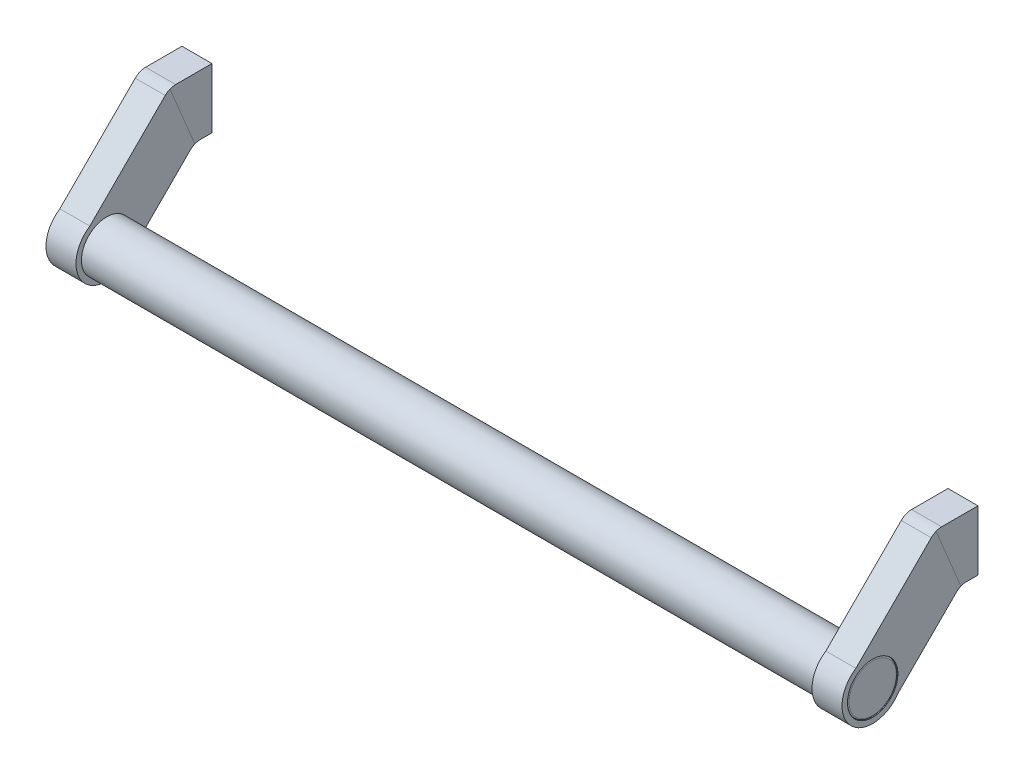
from build123d import *

# Parameters (mm, degrees)
SKETCH3_W                    = 11.938
SKETCH3_H                    = 23.876
HANDLE_START                 = -146.431
SKETCH5_R                    = 12.192
HANDLE_ARM_EXTRUDE_1_DEPTH   = 11.938
SKETCH6_R                    = 12.192
HANDLE_ARM_EXTRUDE_2_DEPTH   = 11.938
HANDLE_CUT_DEPTH             = 173.584963021
HANDLE_CUT_DEPTH_BACK        = 173.584963021
SKETCH7_R                    = 10.033
HANDLE_EXTRUDE_DEPTH         = 158.369
HANDLE_EXTRUDE_DEPTH_BACK    = 158.369
SKETCH8_R                    = 10.033
HANDLE_FILLET_R              = 0.635
HANDLE_ARM_FILLET_R          = 5.842
SKETCH9_R                    = 3.175
HANDLE_THREAD_HOLE_CUT_DEPTH = 12.7
CHAMFER1_SIZE                = 0.635
CUT_SWEEP1_PITCH             = 1.27
LPATTERN1_COUNT              = 2
LPATTERN1_PITCH              = 304.8


with BuildPart() as part:
    # Handle Arm Sweep: sweep along a path in Sketch4
    with BuildLine(Plane(origin=(0, 0, 0), x_dir=(0, 0, -1), z_dir=(1, 0, 0))) as handle_arm_sweep_path:
        Line((0, 0), (-11.938, 0))
        Line((-11.938, 0), (-41.91, -29.972))
    # Sketch3 → Handle Arm Sweep (sweep)
    with BuildSketch(Plane.XY):
        with Locations((152.4, 0)):
            Rectangle(SKETCH3_W, SKETCH3_H)
        with Locations((-152.4, 0)):
            Rectangle(SKETCH3_W, SKETCH3_H)
    sweep(path=handle_arm_sweep_path.line, transition=Transition.RIGHT)

    # Sketch5 → Handle Arm Extrude 1 (add)
    with BuildSketch(Plane(origin=(0, 0, 0), x_dir=(0, 0, -1), z_dir=(1, 0, 0)).offset(HANDLE_START)):
        with Locations((-41.91, -29.972)):
            Circle(SKETCH5_R)
    extrude(amount=-HANDLE_ARM_EXTRUDE_1_DEPTH)

    # Sketch6 → Handle Arm Extrude 2 (add)
    with BuildSketch(Plane(origin=(158.369, 0, 0), x_dir=(0, 0, -1), z_dir=(1, 0, 0))):
        with Locations((-41.91, -29.972)):
            Circle(SKETCH6_R)
    extrude(amount=-HANDLE_ARM_EXTRUDE_2_DEPTH)

    # Sketch7 → Handle Cut (cut, two sides: drawn at the far end of the back side and taken through both)
    with BuildSketch(Plane(origin=(0, 0, 0), x_dir=(0, 0, -1), z_dir=(1, 0, 0)).offset(-HANDLE_CUT_DEPTH_BACK)):
        with Locations((-41.91, -29.972)):
            Circle(SKETCH7_R)
    extrude(amount=HANDLE_CUT_DEPTH + HANDLE_CUT_DEPTH_BACK, mode=Mode.SUBTRACT)


with BuildPart() as body_2:
    # Sketch8 → Handle Extrude (new, two sides: drawn at the far end of the back side and taken through both)
    with BuildSketch(Plane(origin=(0, 0, 0), x_dir=(0, 0, -1), z_dir=(1, 0, 0)).offset(-HANDLE_EXTRUDE_DEPTH_BACK)):
        with Locations(Location((-41.91, -29.972, 0), (0, 0, 180))):
            Circle(SKETCH8_R)
    extrude(amount=HANDLE_EXTRUDE_DEPTH + HANDLE_EXTRUDE_DEPTH_BACK)

    # Handle Fillet
    handle_fillet_edges = [body_2.edges().sort_by_distance(p)[0] for p in [
        (-158.369, -29.972, 31.877),
        (158.369, -29.972, 31.877),
    ]]
    fillet(handle_fillet_edges, radius=HANDLE_FILLET_R)


with BuildPart() as part_1:
    add(part.part)

    # Handle Combine: union body 2
    add(body_2.part)

    # Handle Arm Fillet
    handle_arm_fillet_edges = [part_1.edges().sort_by_distance(p)[0] for p in [
        (-152.4, 11.938, 16.882881508),
        (-152.4, -11.938, 6.993118492),
        (152.4, 11.938, 16.882881508),
        (152.4, -11.938, 6.993118492),
    ]]
    fillet(handle_arm_fillet_edges, radius=HANDLE_ARM_FILLET_R)

    # Sketch9 → Handle Thread Hole Cut (cut)
    with BuildSketch(Plane(origin=(0, 0, 0), x_dir=(-1, 0, 0), z_dir=(0, 0, -1))):
        with Locations((152.4, 0)):
            Circle(SKETCH9_R)
        with Locations((-152.4, 0)):
            Circle(SKETCH9_R)
    extrude(amount=-HANDLE_THREAD_HOLE_CUT_DEPTH, mode=Mode.SUBTRACT)

    # Chamfer1
    chamfer1_edges = [part_1.edges().sort_by_distance(p)[0] for p in [
        (-149.225, 0, 0),
        (155.575, 0, 0),
    ]]
    chamfer(chamfer1_edges, length=CHAMFER1_SIZE)

    # Cut-Sweep1: arcs per turn and ends read off the stored shape
    # Cut-Sweep1: the profile of Sketch11 screwed along a right-hand helix through 11 turns, 8 arcs to a turn; built about Z, then put on its axis
    cut_sweep1_z = Axis((0, 0, 0), (0, 0, 1))
    cut_sweep1_corners = [(3.106259234, 0, 0.0396875), (3.106259234, 0, -1.1509375), (3.999889197, 0, -0.635), (3.999889197, 0, -0.47625)]
    with BuildLine(mode=Mode.PRIVATE) as cut_sweep1_profile:
        Line(cut_sweep1_corners[0], cut_sweep1_corners[1])
        Line(cut_sweep1_corners[1], cut_sweep1_corners[2])
        Line(cut_sweep1_corners[2], cut_sweep1_corners[3])
        Line(cut_sweep1_corners[3], cut_sweep1_corners[0])
    cut_sweep1_cap = Face(cut_sweep1_profile.wire())
    cut_sweep1_turn_angles = [0, 22.5, 45, 67.5, 90, 112.5, 135, 157.5, 180, 202.5, 225, 247.5, 270, 292.5, 315, 337.5, 360]
    cut_sweep1_turn_weights = [1, 0.9238795325112867, 1, 0.9238795325112867, 1, 0.9238795325112867, 1, 0.9238795325112867, 1, 0.9238795325112867, 1, 0.9238795325112867, 1, 0.9238795325112867, 1, 0.9238795325112867, 1]
    cut_sweep1_turn_rails = [Edge.make_bspline([Vector(p[0], p[1], 0).rotate(cut_sweep1_z, cut_sweep1_turn_angles[k]) / cut_sweep1_turn_weights[k] + Vector(0, 0, p[2] + CUT_SWEEP1_PITCH * cut_sweep1_turn_angles[k] / 360) for k in range(17)], [0, 0, 0, 1, 1, 2, 2, 3, 3, 4, 4, 5, 5, 6, 6, 7, 7, 8, 8, 8], 2, cut_sweep1_turn_weights) for p in cut_sweep1_corners]
    cut_sweep1_turn_sides = [Face.make_surface_from_curves(cut_sweep1_turn_rails[p[0]], cut_sweep1_turn_rails[p[1]]) for p in [(0, 1), (1, 2), (2, 3), (3, 0)]]
    cut_sweep1 = Plane(origin=(152.4, 0, 0), x_dir=(1, 0, 0), z_dir=(0, 0, 1)) * Solid(Shell([*[p.moved(Location((0, 0, CUT_SWEEP1_PITCH * i))) for i in range(11) for p in cut_sweep1_turn_sides], cut_sweep1_cap, cut_sweep1_cap.rotate(cut_sweep1_z, 3960).moved(Location((0, 0, CUT_SWEEP1_PITCH * 3960 / 360)))]))
    add(cut_sweep1, mode=Mode.SUBTRACT)

    # LPattern1: Cut-Sweep1 ×2
    with Locations(*[(-i * LPATTERN1_PITCH, 0, 0) for i in range(1, LPATTERN1_COUNT)]):
        add(cut_sweep1, mode=Mode.SUBTRACT)


solid = part_1.part
